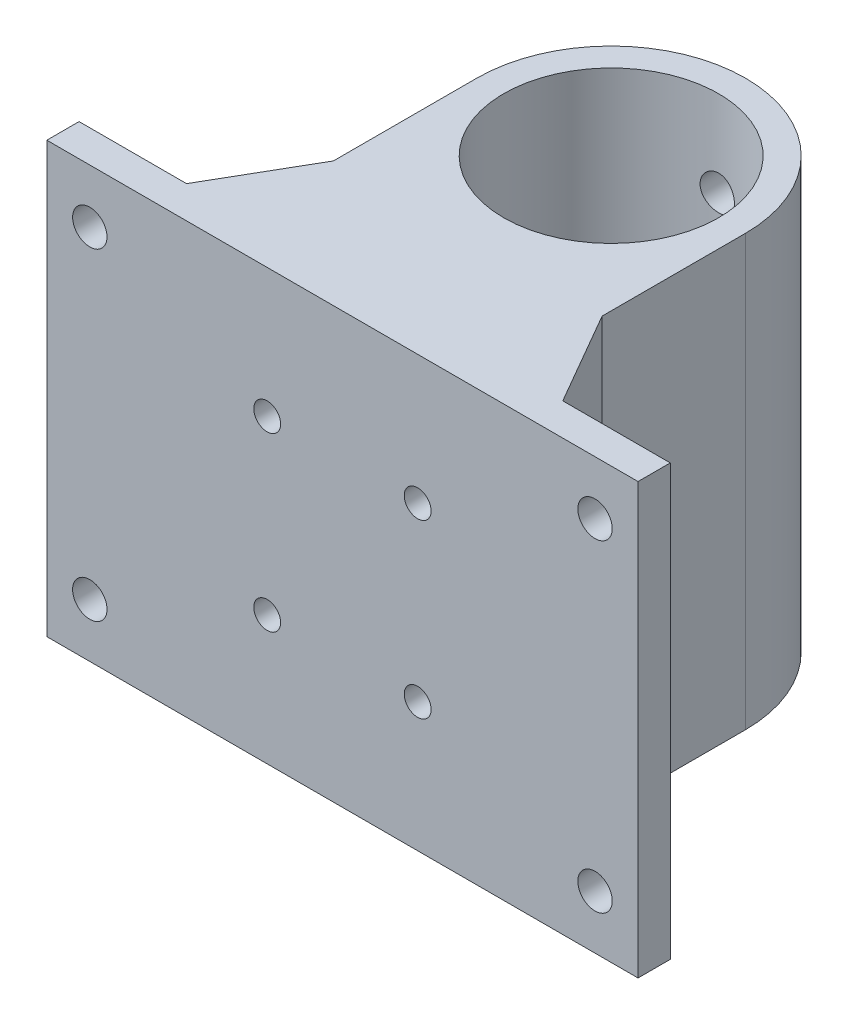
from build123d import *
from OCP.BRepFilletAPI import BRepFilletAPI_MakeChamfer

# Parameters (mm, degrees)
SKETCH_1_R             = 10
EXTRUDE_1_DEPTH        = 20
SKETCH_7_R             = 1.6
CUT_EXTRUDE_2_DEPTH    = 35.369317712
HOLE_WIZARD_M3_1_D     = 2.5
HOLE_WIZARD_M3_1_DEPTH = 9.5
HOLE_WIZARD_M3_1_TIP   = 0.751075774
SKETCH_9_W             = 3
SKETCH_9_H             = 40
EXTRUDE_2_DEPTH        = 15
SKETCH_10_R            = 1.6
CUT_EXTRUDE_3_DEPTH    = 49.440685513
CHAMFER_1_SIZE         = 5
CHAMFER_1_SIZE2        = 8.660254038


with BuildPart() as part:
    # 草图1 → 凸台-拉伸1 (new, symmetric)
    with BuildSketch(Plane(origin=(0, 0, 0), x_dir=(1, 0, 0), z_dir=(0, 1, 0))):
        with BuildLine():
            Line((-12.5, -25), (12.5, -25))
            Line((12.5, -25), (12.5, 0))
            ThreePointArc((12.5, 0), (0, 12.5), (-12.5, 0))
            Line((-12.5, 0), (-12.5, -25))
        make_face()
        Circle(SKETCH_1_R, mode=Mode.SUBTRACT)
    extrude(amount=EXTRUDE_1_DEPTH, both=True)

    # 草图7 → 切除-拉伸2 (cut, through all)
    with BuildSketch(Plane.XY):
        with Locations((0, -12)):
            Circle(SKETCH_7_R)
        with Locations((0, 12)):
            Circle(SKETCH_7_R)
    extrude(amount=-CUT_EXTRUDE_2_DEPTH, mode=Mode.SUBTRACT)

    # M3 螺纹孔1
    with Locations(Plane(origin=(-7, -8, 25), x_dir=(1, 0, 0), z_dir=(0, 0, 1))):
        with Locations((0, 0), (14, 0), (14, 16), (0, 16)):
            Hole(HOLE_WIZARD_M3_1_D / 2, depth=HOLE_WIZARD_M3_1_DEPTH)
            with Locations((0, 0, -(HOLE_WIZARD_M3_1_DEPTH + HOLE_WIZARD_M3_1_TIP / 2))):  # 118° drill point
                Cone(0, HOLE_WIZARD_M3_1_D / 2, HOLE_WIZARD_M3_1_TIP, mode=Mode.SUBTRACT)

    # 草图9 → 凸台-拉伸2 (add)
    with BuildSketch(Plane(origin=(12.5, 0, 0), x_dir=(0, 0, -1), z_dir=(1, 0, 0))):
        with Locations((-23.5, 0)):
            Rectangle(SKETCH_9_W, SKETCH_9_H)
    extrude_2 = extrude(amount=EXTRUDE_2_DEPTH)

    # 草图10 → 切除-拉伸3 (cut, through all)
    with BuildSketch(Plane(origin=(0, 0, 22), x_dir=(-1, 0, 0), z_dir=(0, 0, -1))):
        with Locations((-23.5, 15)):
            Circle(SKETCH_10_R)
        with Locations((-23.5, -15)):
            Circle(SKETCH_10_R)
    cut_extrude_3 = extrude(amount=-CUT_EXTRUDE_3_DEPTH, mode=Mode.SUBTRACT)

    # 镜向6: 凸台-拉伸2, 切除-拉伸3 across plane
    add(extrude_2.mirror(Plane(origin=(0, 0, 0), x_dir=(0, 0, 1), z_dir=(1, 0, 0))))
    add(cut_extrude_3.mirror(Plane(origin=(0, 0, 0), x_dir=(0, 0, 1), z_dir=(1, 0, 0))), mode=Mode.SUBTRACT)

    # 倒角1: one chamfer whose edges measure the first distance from different faces: ONE call of the kernel's chamfer builder (chamfer() names one face for all edges)
    chamfer_1_edges_1 = [part.edges().sort_by_distance(p)[0] for p in [
        (12.5, 0, 22),
    ]]
    chamfer_1_side_1 = [part.faces().sort_by_distance(p)[0] for p in [
        (19.903586419, 0, 22),
    ]]
    chamfer_1_edges_2 = [part.edges().sort_by_distance(p)[0] for p in [
        (-12.5, 0, 22),
    ]]
    chamfer_1_side_2 = [part.faces().sort_by_distance(p)[0] for p in [
        (-19.903586419, 0, 22),
    ]]
    chamfer_1 = BRepFilletAPI_MakeChamfer(part.part.solid().wrapped)
    for e in chamfer_1_edges_1:
        chamfer_1.Add(CHAMFER_1_SIZE, CHAMFER_1_SIZE2, e.wrapped, chamfer_1_side_1[0].wrapped)  # the first distance lies on this face
    for e in chamfer_1_edges_2:
        chamfer_1.Add(CHAMFER_1_SIZE, CHAMFER_1_SIZE2, e.wrapped, chamfer_1_side_2[0].wrapped)  # the first distance lies on this face
    add(Compound.cast(chamfer_1.Shape()), mode=Mode.REPLACE)


solid = part.part
